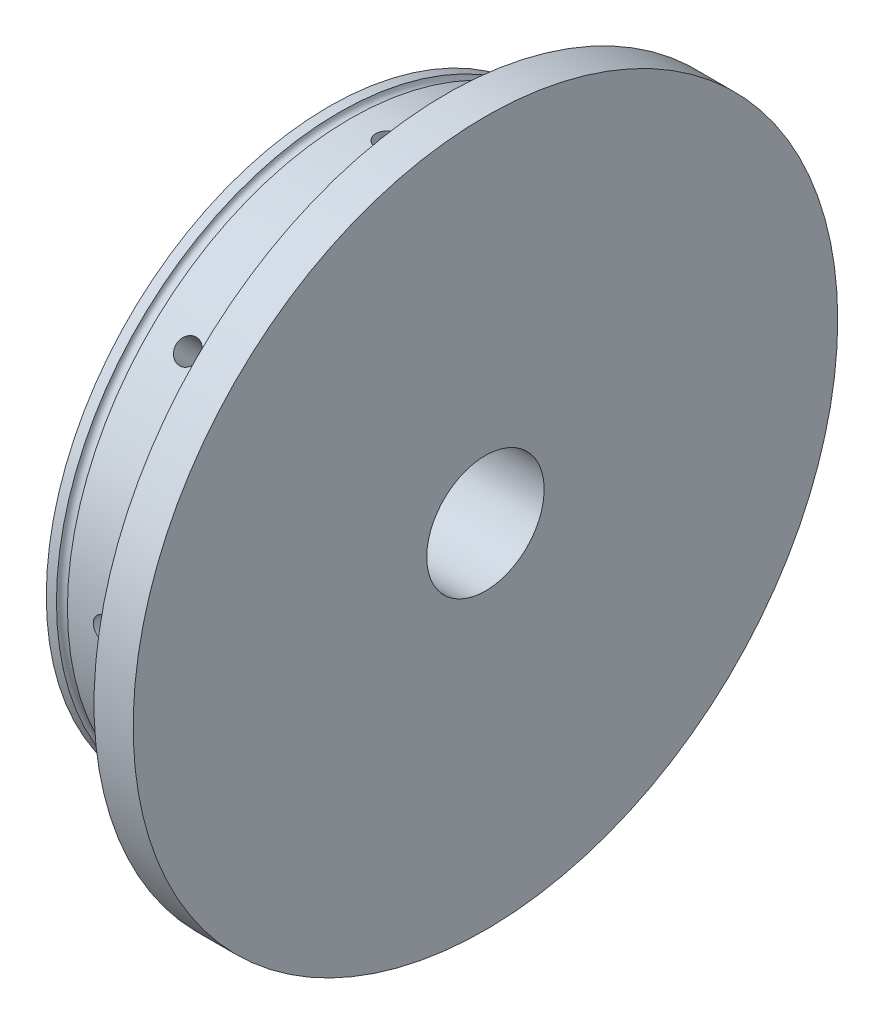
from build123d import *

# Parameters (mm, degrees)
SKETCH1_R           = 57.15
BOSS_EXTRUDE1_DEPTH = 6.35
SKETCH2_R           = 45.847
BOSS_EXTRUDE2_DEPTH = 19.05
SKETCH3_R           = 34.925
CUT_EXTRUDE1_DEPTH  = 3.175
SKETCH4_R           = 9.525
CUT_EXTRUDE2_DEPTH  = 84.822405269
SKETCH5_R           = 0.889
SKETCH6_R           = 1.905
CUT_EXTRUDE3_DEPTH  = 6.35
CIRPATTERN1_COUNT   = 8


with BuildPart() as part:
    # Sketch1 → Boss-Extrude1 (new body)
    with BuildSketch(Plane(origin=(0, 0, 0), x_dir=(0, 0, -1), z_dir=(1, 0, 0))):
        Circle(SKETCH1_R)
    extrude(amount=BOSS_EXTRUDE1_DEPTH)

    # Sketch2 → Boss-Extrude2 (add)
    with BuildSketch(Plane.ZY):
        Circle(SKETCH2_R)
    extrude(amount=BOSS_EXTRUDE2_DEPTH)

    # Sketch3 → Cut-Extrude1 (cut)
    with BuildSketch(Plane.ZY.offset(19.05)):
        Circle(SKETCH3_R)
    extrude(amount=-CUT_EXTRUDE1_DEPTH, mode=Mode.SUBTRACT)

    # Sketch4 → Cut-Extrude2 (cut, through all)
    with BuildSketch(Plane.ZY.offset(15.875)):
        Circle(SKETCH4_R)
    extrude(amount=-CUT_EXTRUDE2_DEPTH, mode=Mode.SUBTRACT)

    # Sketch5 → Cut-Revolve1 (revolve, cut)
    with BuildSketch(Plane.XY):
        with Locations((-16.51, 45.847)):
            Circle(SKETCH5_R)
    revolve(axis=Axis((0, 0, 0), (-1, 0, 0)), mode=Mode.SUBTRACT)

    # Sketch6 → Cut-Extrude3 (cut)
    with BuildSketch(Plane.XY.offset(45.847)):
        with Locations((-9.525, 0)):
            Circle(SKETCH6_R)
    cut_extrude3 = extrude(amount=-CUT_EXTRUDE3_DEPTH, mode=Mode.SUBTRACT)

    # CirPattern1: Cut-Extrude3 ×8 about axis
    cirpattern1_axis = Axis((-19.05, 0, 0), (1, 0, 0))
    for i in range(1, CIRPATTERN1_COUNT):
        add(cut_extrude3.rotate(cirpattern1_axis, i * 360 / CIRPATTERN1_COUNT), mode=Mode.SUBTRACT)


solid = part.part
